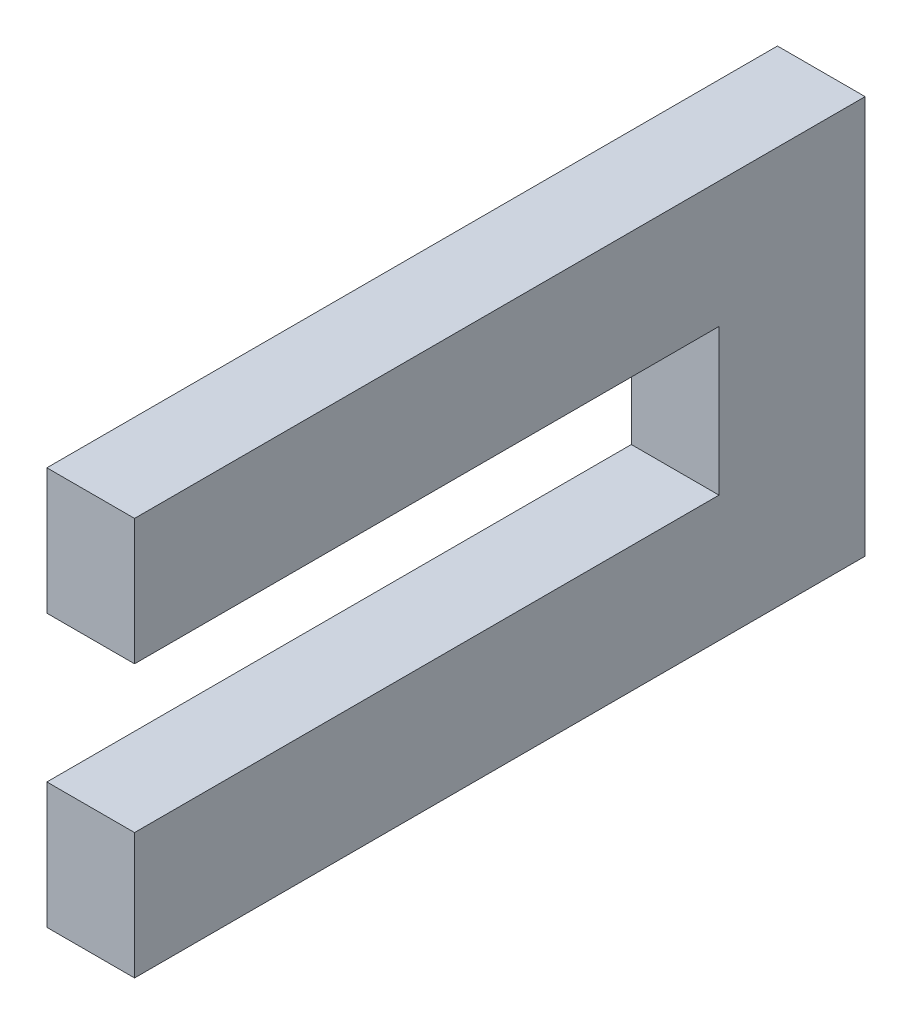
from build123d import *

# Parameters (mm, degrees)
BOSS_EXTRUDE1_DEPTH = 3


with BuildPart() as part:
    # Sketch2 → Boss-Extrude1 (new body)
    with BuildSketch(Plane(origin=(0, 0, 0), x_dir=(0, 0, -1), z_dir=(1, 0, 0))):
        Polygon((-20.452745578, -4.388518255), (4.547254422, -4.388518255), (4.547254422, -18.00920791), (-20.452745578, -18.00920791), (-20.452745578, -13.698863083), (-0.452745578, -13.698863083), (-0.452745578, -8.698863083), (-20.452745578, -8.698863083), align=None)
    extrude(amount=BOSS_EXTRUDE1_DEPTH)


solid = part.part
